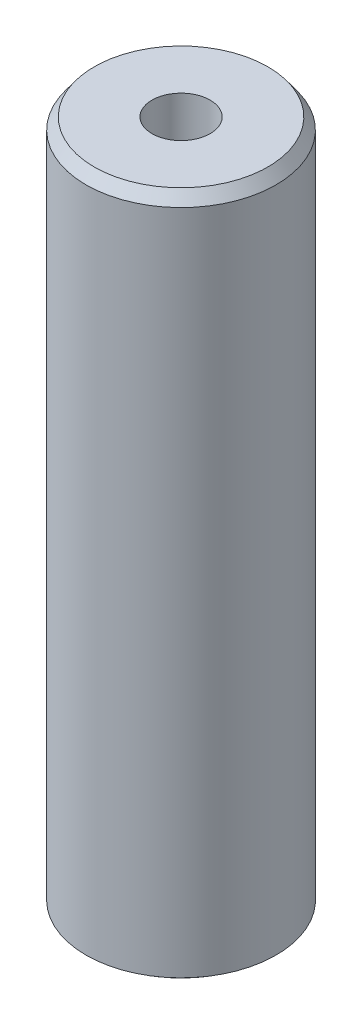
from build123d import *
from OCP.BRepFilletAPI import BRepFilletAPI_MakeChamfer

# Parameters (mm, degrees)
SKETCH1_R           = 40
BOSS_EXTRUDE1_DEPTH = 289.018235415
SKETCH2_R           = 12.243230417
CUT_EXTRUDE1_DEPTH  = 295.502190828
CHAMFER1_SIZE       = 4.788433437
CHAMFER1_SIZE2      = 3.450960296


with BuildPart() as part:
    # Sketch1 → Boss-Extrude1 (new body)
    with BuildSketch(Plane(origin=(0, 0, 0), x_dir=(1, 0, 0), z_dir=(0, 1, 0))):
        Circle(SKETCH1_R)
    extrude(amount=BOSS_EXTRUDE1_DEPTH)

    # Sketch2 → Cut-Extrude1 (cut, through all)
    with BuildSketch(Plane(origin=(0, 0, 0), x_dir=(1, 0, 0), z_dir=(0, 1, 0))):
        Circle(SKETCH2_R)
    extrude(amount=CUT_EXTRUDE1_DEPTH, mode=Mode.SUBTRACT)

    # Chamfer1: one chamfer whose edges measure the first distance from different faces: ONE call of the kernel's chamfer builder (chamfer() names one face for all edges)
    chamfer1_edges_1 = [part.edges().sort_by_distance(p)[0] for p in [
        (-40, 289.018235415, 0),
    ]]
    chamfer1_side_1 = [part.faces().sort_by_distance(p)[0] for p in [
        (-40, 144.509117708, 0),
    ]]
    chamfer1_edges_2 = [part.edges().sort_by_distance(p)[0] for p in [
        (-40, 0, 0),
    ]]
    chamfer1_side_2 = [part.faces().sort_by_distance(p)[0] for p in [
        (-38.86862915, 0, 0),
    ]]
    chamfer1 = BRepFilletAPI_MakeChamfer(part.part.solid().wrapped)
    for e in chamfer1_edges_1:
        chamfer1.Add(CHAMFER1_SIZE, CHAMFER1_SIZE2, e.wrapped, chamfer1_side_1[0].wrapped)  # the first distance lies on this face
    for e in chamfer1_edges_2:
        chamfer1.Add(CHAMFER1_SIZE, CHAMFER1_SIZE2, e.wrapped, chamfer1_side_2[0].wrapped)  # the first distance lies on this face
    add(Compound.cast(chamfer1.Shape()), mode=Mode.REPLACE)


solid = part.part
